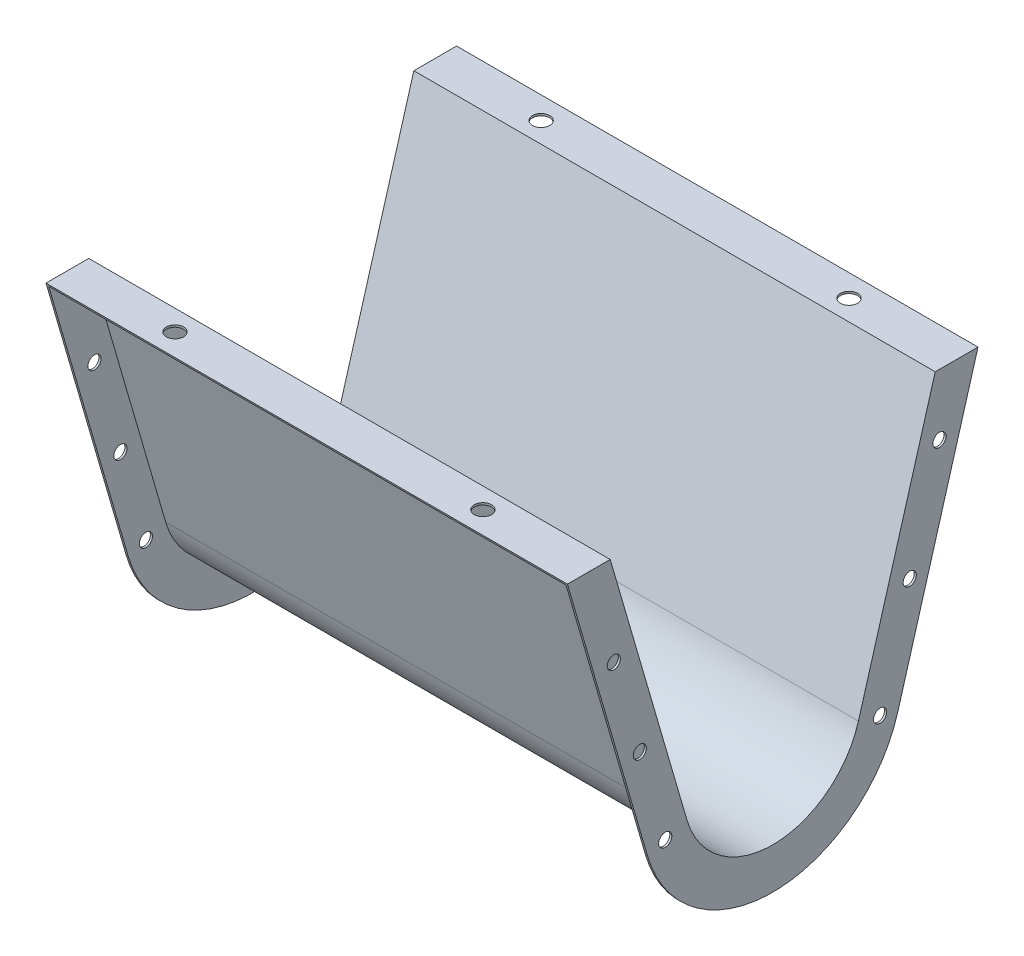
from build123d import *

# Parameters (mm, degrees)
SALIENTE_EXTRUIR1_DEPTH                = 254
VACIADO1_T                             = -1
TALADRO_DE_MARGEN_PARA_M61_D           = 6.4
TALADRO_DE_MARGEN_PARA_M61_ON_FACE_2_D = 6.4
TALADRO_DE_MARGEN_PARA_M82_D           = 8.4


with BuildPart() as part:
    # Croquis1 → Saliente-Extruir1 (new body)
    with BuildSketch(Plane(origin=(0, 0, 0), x_dir=(0, 0, -1), z_dir=(1, 0, 0))):
        with BuildLine():
            Line((79.17187299860358, 0), (100, 0))
            Line((100, 0), (60.975237951777956, -134.227672061612))
            ThreePointArc((60.975237951777956, -134.227672061612), (38.12179707259116, -167.28364488648072), (1.084e-14, -180))
            ThreePointArc((1.084e-14, -180), (-38.12179707259115, -167.28364488648072), (-60.97523795177794, -134.227672061612))
            Line((-60.97523795177794, -134.227672061612), (-100, -1.214e-14))
            Line((-100, -1.214e-14), (-79.17187299860355, -1.001e-14))
            Line((-79.17187299860355, -1.001e-14), (-41.7704385968872, -128.64415330204915))
            ThreePointArc((-41.7704385968872, -128.64415330204915), (-26.114931852877397, -151.28879610333718), (-5.64e-15, -159.99999999999997))
            ThreePointArc((-5.64e-15, -159.99999999999997), (26.114931852877387, -151.28879610333718), (41.770438596887246, -128.64415330204915))
            Line((41.770438596887246, -128.64415330204915), (79.17187299860358, 0))
        make_face()
    extrude(amount=SALIENTE_EXTRUIR1_DEPTH)

    # Vaciado1
    vaciado1_openings = [part.faces().sort_by_distance(p)[0] for p in [
        (127, -67.113836031, -80.487618976),
        (127, -180, 0),
        (127, -67.113836031, 80.487618976),
    ]]
    offset(amount=VACIADO1_T, openings=vaciado1_openings, kind=Kind.INTERSECTION)

    # Taladro de margen para M61 (through all)
    with Locations(Plane(origin=(253, -44.256705559, 77.411976307), x_dir=(0, 0, -1), z_dir=(-1, 0, 0))):
        with Locations((0, 0), (12.664768735, 44.166346516), (25.068696507, 87.423052075), (158.634855985, -14.506711632), (144.158044599, 36.862180817), (129.705521044, 87.375003987)):
            Hole(TALADRO_DE_MARGEN_PARA_M61_D / 2)

    # Taladro de margen para M61 on face 2 (through all)
    with Locations(Plane(origin=(1, -29.749993927, -81.222879678), x_dir=(0, 0, 1), z_dir=(1, 0, 0))):
        with Locations((0, 0), (14.476811386, 51.368892449), (28.929334941, 101.881715619), (133.566159478, 101.929763707), (145.97008725, 58.673058148), (158.634855985, 14.506711632)):
            Hole(TALADRO_DE_MARGEN_PARA_M61_ON_FACE_2_D / 2)

    # Taladro de margen para M82 (through all)
    with Locations(Plane(origin=(201.999175728, 0, -89.171872999), x_dir=(0, 0, 1), z_dir=(0, 1, 0))):
        with Locations((0, 0), (0, -150), (178.343745998, -149.999175728), (178.343745998, 0.000824272)):
            Hole(TALADRO_DE_MARGEN_PARA_M82_D / 2)


solid = part.part
